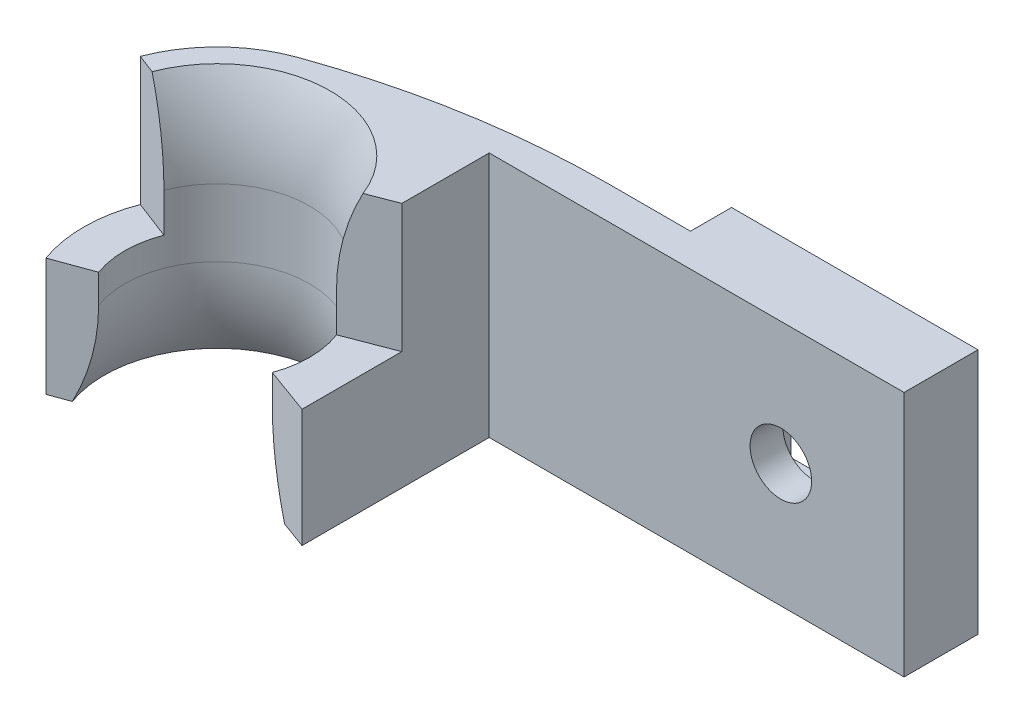
from build123d import *

# Parameters (mm, degrees)
BOSS_EXTRUDE1_DEPTH = 6
CUT_EXTRUDE1_REACH  = 30.66
SKETCH3_R           = 1.5
BOSS_EXTRUDE2_DEPTH = 5.75
CUT_EXTRUDE2_START  = 6.25
CUT_EXTRUDE2_DEPTH  = 6.25
CHAMFER1_SIZE       = 1
FILLET1_R           = 10
SKETCH7_W           = 2
SKETCH7_H           = 12
BOSS_EXTRUDE3_DEPTH = 6
SKETCH8_W           = 6.2
SKETCH8_H           = 6.2
CUT_EXTRUDE3_DEPTH  = 2


with BuildPart() as part:
    # Sketch2 → Boss-Extrude1 (new, symmetric)
    with BuildSketch(Plane(origin=(0, 0, 0), x_dir=(1, 0, 0), z_dir=(0, 1, 0))):
        with BuildLine():
            Line((6, 6.75), (-14.2, 6.75))
            Line((-14.2, 6.75), (-14.2, 0))
            Line((-14.2, 0), (-16.2, 0))
            ThreePointArc((-16.2, 0), (-20.7, 4.5), (-25.2, 0))
            Line((-25.2, 0), (-27.2, 0))
            ThreePointArc((-27.2, 0), (-26.012050082, 3.745947667), (-22.882423407, 6.122665112))
            ThreePointArc((-22.882423407, 6.122665112), (-16.536777753, 7.78906592), (-10, 8.35))
            Line((-10, 8.35), (6, 8.35))
            Line((6, 8.35), (6, 6.75))
        make_face()
    extrude(amount=BOSS_EXTRUDE1_DEPTH, both=True)

    # Sketch3 → Cut-Extrude1 (cut, up to next)
    with BuildSketch(Plane.XY.offset(-6.75), mode=Mode.PRIVATE) as cut_extrude1_sk1:
        Circle(SKETCH3_R)
    cut_extrude1_tool1 = extrude(cut_extrude1_sk1.sketch, amount=-CUT_EXTRUDE1_REACH, mode=Mode.PRIVATE) & part.part
    add(cut_extrude1_tool1.solids().sort_by_distance((0, 0, -6.75))[0], mode=Mode.SUBTRACT)

    # Sketch5 → Boss-Extrude2 (add)
    with BuildSketch(Plane(origin=(0, -0.25, 0), x_dir=(1, 0, 0), z_dir=(0, 1, 0))):
        with BuildLine():
            Line((-24.928616794, -1.539090645), (-26.808002035, -2.223130932))
            ThreePointArc((-26.808002035, -2.223130932), (-21.828713155, 6.401250395), (-14.2, 0))
            Line((-14.2, 0), (-14.2, -2.365806523))
            Line((-14.2, -2.365806523), (-16.471383206, -1.539090645))
            ThreePointArc((-16.471383206, -1.539090645), (-20.7, 4.5), (-24.928616794, -1.539090645))
        make_face()
    extrude(amount=-BOSS_EXTRUDE2_DEPTH)

    # Sketch6 → Cut-Extrude2 (cut)
    with BuildSketch(Plane(origin=(0, -0.25, 0), x_dir=(1, 0, 0), z_dir=(0, 1, 0)).offset(CUT_EXTRUDE2_START)):
        with BuildLine():
            Line((-24.901111919, 1.612655773), (-26.768272772, 2.329391672))
            ThreePointArc((-26.768272772, 2.329391672), (-21.884530916, -6.391156899), (-14.2, 0))
            Line((-14.2, 0), (-14.2, 2.495116228))
            Line((-14.2, 2.495116228), (-16.498888081, 1.612655773))
            ThreePointArc((-16.498888081, 1.612655773), (-20.7, -4.5), (-24.901111919, 1.612655773))
        make_face()
    extrude(amount=-CUT_EXTRUDE2_DEPTH, mode=Mode.SUBTRACT)

    # Chamfer1
    chamfer1_edges = [part.edges().sort_by_distance(p)[0] for p in [
        (-20.7, -6, -4.5),
        (-20.7, 6, -4.5),
    ]]
    chamfer(chamfer1_edges, length=CHAMFER1_SIZE)

    # Fillet1
    # the kernel refuses this fillet: 10 mm, written as the material it takes off along each edge
    with BuildSketch(Plane(origin=(-20.7, -5, 0), x_dir=(0.003141587485880374, 0, 0.9999950652018581), z_dir=(-0.9999950652018581, 0, 0.003141587485880374))) as fillet1_piece_1:
        with BuildLine():
            CenterArc((14.5, 3.358898944), FILLET1_R, 180, 25.841932763)
            Line((5.5, -1), (5.32, -1.087177979))
            ThreePointArc((5.32, -1.087177979), (4.858578644, -0.641421356), (4.358578644, -0.141421356))
            Line((4.358578644, -0.141421356), (4.3, 0))
            Line((4.3, 0), (4.3, 3.358898944))
            Line((4.3, 3.358898944), (4.5, 3.358898944))
        make_face()
    revolve(axis=Axis((-20.7, -5, 0), (0, 1, 0)), revolution_arc=359.64, mode=Mode.SUBTRACT)
    with BuildSketch(Plane(origin=(-20.7, 5, 0), x_dir=(0.06944148542988178, 0, 0.9975860264164146), z_dir=(-0.9975860264164146, 0, 0.06944148542988178))) as fillet1_piece_2:
        with BuildLine():
            CenterArc((14.5, -3.358898944), FILLET1_R, 154.158067237, 25.841932763)
            Line((5.5, 1), (5.32, 1.087177979))
            ThreePointArc((5.32, 1.087177979), (4.858578644, 0.641421356), (4.358578644, 0.141421356))
            Line((4.358578644, 0.141421356), (4.3, 0))
            Line((4.3, 0), (4.3, -3.358898944))
            Line((4.3, -3.358898944), (4.5, -3.358898944))
        make_face()
    revolve(axis=Axis((-20.7, 5, 0), (0, 1, 0)), revolution_arc=352.036182743, mode=Mode.SUBTRACT)

    # Sketch7 → Boss-Extrude3 (add, symmetric)
    with BuildSketch(Plane(origin=(0, 0, 0), x_dir=(0, 0, -1), z_dir=(1, 0, 0))):
        with Locations((9.35, 0)):
            Rectangle(SKETCH7_W, SKETCH7_H)
    extrude(amount=BOSS_EXTRUDE3_DEPTH, both=True)

    # Sketch8 → Cut-Extrude3 (cut)
    with BuildSketch(Plane(origin=(0, 0, -10.35), x_dir=(-1, 0, 0), z_dir=(0, 0, -1))):
        Rectangle(SKETCH8_W, SKETCH8_H)
    extrude(amount=-CUT_EXTRUDE3_DEPTH, mode=Mode.SUBTRACT)


solid = part.part
